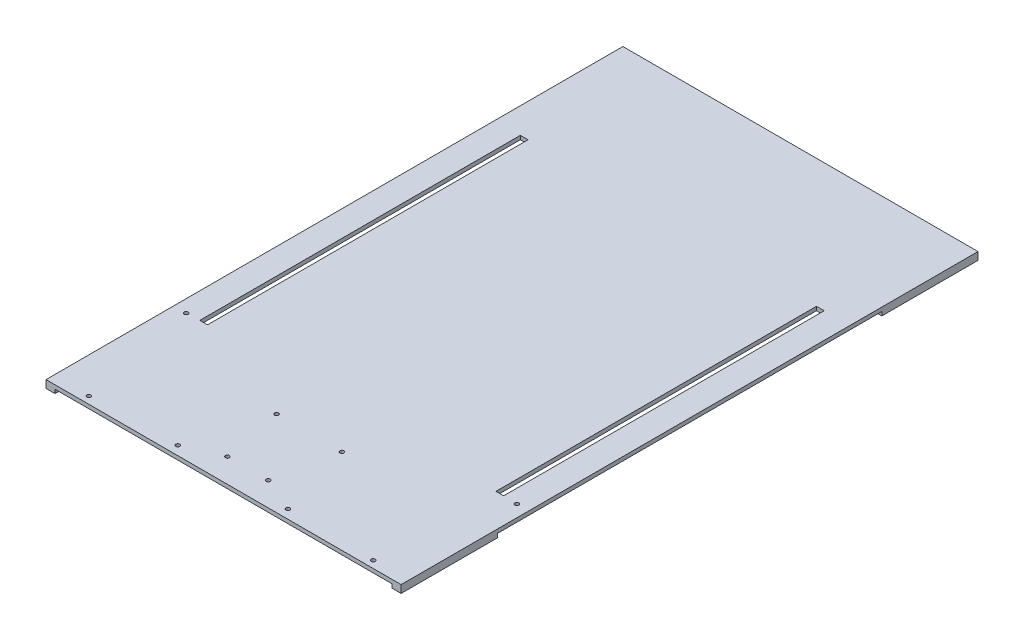
from build123d import *

# Parameters (mm, degrees)
SKETCH1_W           = 277
SKETCH1_H           = 3
BOSS_EXTRUDE1_DEPTH = 450
CUT_EXTRUDE1_REACH  = 520.295
SKETCH2_W           = 6
SKETCH2_H           = 250
CUT_EXTRUDE2_REACH  = 520.295
SKETCH3_R           = 1.55
SKETCH4_W           = 7
SKETCH4_H           = 75
SKETCH4_W_2         = 5
SKETCH4_H_2         = 35
BOSS_EXTRUDE2_DEPTH = 3


with BuildPart() as part:
    # Sketch1 → Boss-Extrude1 (new body)
    with BuildSketch(Plane.XY):
        with Locations((-118.640040599, -13.427850278)):
            Rectangle(SKETCH1_W, SKETCH1_H)
    extrude(amount=BOSS_EXTRUDE1_DEPTH)

    # Sketch2 → Cut-Extrude1 (cut, up to next)
    with BuildSketch(Plane(origin=(0, -11.927850278, 0), x_dir=(1, 0, 0), z_dir=(0, 1, 0)), mode=Mode.PRIVATE) as cut_extrude1_sk1:
        with Locations((-234.140040599, -225)):
            Rectangle(SKETCH2_W, SKETCH2_H)
    cut_extrude1_tool1 = extrude(cut_extrude1_sk1.sketch, amount=-CUT_EXTRUDE1_REACH, mode=Mode.PRIVATE) & part.part
    # Sketch2 → Cut-Extrude1 (cut, up to next)
    with BuildSketch(Plane(origin=(0, -11.927850278, 0), x_dir=(1, 0, 0), z_dir=(0, 1, 0)), mode=Mode.PRIVATE) as cut_extrude1_sk2:
        with Locations((-3.140040599, -225)):
            Rectangle(SKETCH2_W, SKETCH2_H)
    cut_extrude1_tool2 = extrude(cut_extrude1_sk2.sketch, amount=-CUT_EXTRUDE1_REACH, mode=Mode.PRIVATE) & part.part
    add(cut_extrude1_tool1.solids().sort_by_distance((-234.140041, -11.92785, 225))[0], mode=Mode.SUBTRACT)
    add(cut_extrude1_tool2.solids().sort_by_distance((-3.140041, -11.92785, 225))[0], mode=Mode.SUBTRACT)

    # Sketch3 → Cut-Extrude2 (cut, up to next)
    with BuildSketch(Plane(origin=(0, -11.927850278, 0), x_dir=(1, 0, 0), z_dir=(0, 1, 0)), mode=Mode.PRIVATE) as cut_extrude2_sk1:
        with Locations((-102.460040599, -431.322984009)):
            Circle(SKETCH3_R)
    cut_extrude2_tool1 = extrude(cut_extrude2_sk1.sketch, amount=-CUT_EXTRUDE2_REACH, mode=Mode.PRIVATE) & part.part
    # Sketch3 → Cut-Extrude2 (cut, up to next)
    with BuildSketch(Plane(origin=(0, -11.927850278, 0), x_dir=(1, 0, 0), z_dir=(0, 1, 0)), mode=Mode.PRIVATE) as cut_extrude2_sk2:
        with Locations((-75.460040599, -442.983238046)):
            Circle(SKETCH3_R)
    cut_extrude2_tool2 = extrude(cut_extrude2_sk2.sketch, amount=-CUT_EXTRUDE2_REACH, mode=Mode.PRIVATE) & part.part
    # Sketch3 → Cut-Extrude2 (cut, up to next)
    with BuildSketch(Plane(origin=(0, -11.927850278, 0), x_dir=(1, 0, 0), z_dir=(0, 1, 0)), mode=Mode.PRIVATE) as cut_extrude2_sk3:
        with Locations((-92.910040599, -383.404829271)):
            Circle(SKETCH3_R)
    cut_extrude2_tool3 = extrude(cut_extrude2_sk3.sketch, amount=-CUT_EXTRUDE2_REACH, mode=Mode.PRIVATE) & part.part
    # Sketch3 → Cut-Extrude2 (cut, up to next)
    with BuildSketch(Plane(origin=(0, -11.927850278, 0), x_dir=(1, 0, 0), z_dir=(0, 1, 0)), mode=Mode.PRIVATE) as cut_extrude2_sk4:
        with Locations((10.539959401, -350.404829271)):
            Circle(SKETCH3_R)
    cut_extrude2_tool4 = extrude(cut_extrude2_sk4.sketch, amount=-CUT_EXTRUDE2_REACH, mode=Mode.PRIVATE) & part.part
    # Sketch3 → Cut-Extrude2 (cut, up to next)
    with BuildSketch(Plane(origin=(0, -11.927850278, 0), x_dir=(1, 0, 0), z_dir=(0, 1, 0)), mode=Mode.PRIVATE) as cut_extrude2_sk5:
        with Locations((-7.460040599, -444.433238046)):
            Circle(SKETCH3_R)
    cut_extrude2_tool5 = extrude(cut_extrude2_sk5.sketch, amount=-CUT_EXTRUDE2_REACH, mode=Mode.PRIVATE) & part.part
    # Sketch3 → Cut-Extrude2 (cut, up to next)
    with BuildSketch(Plane(origin=(0, -11.927850278, 0), x_dir=(1, 0, 0), z_dir=(0, 1, 0)), mode=Mode.PRIVATE) as cut_extrude2_sk6:
        with Locations((-247.340040599, -350.40562763)):
            Circle(SKETCH3_R)
    cut_extrude2_tool6 = extrude(cut_extrude2_sk6.sketch, amount=-CUT_EXTRUDE2_REACH, mode=Mode.PRIVATE) & part.part
    # Sketch3 → Cut-Extrude2 (cut, up to next)
    with BuildSketch(Plane(origin=(0, -11.927850278, 0), x_dir=(1, 0, 0), z_dir=(0, 1, 0)), mode=Mode.PRIVATE) as cut_extrude2_sk7:
        with Locations((-229.340040599, -444.434036405)):
            Circle(SKETCH3_R)
    cut_extrude2_tool7 = extrude(cut_extrude2_sk7.sketch, amount=-CUT_EXTRUDE2_REACH, mode=Mode.PRIVATE) & part.part
    # Sketch3 → Cut-Extrude2 (cut, up to next)
    with BuildSketch(Plane(origin=(0, -11.927850278, 0), x_dir=(1, 0, 0), z_dir=(0, 1, 0)), mode=Mode.PRIVATE) as cut_extrude2_sk8:
        with Locations((-161.340040599, -442.984036405)):
            Circle(SKETCH3_R)
    cut_extrude2_tool8 = extrude(cut_extrude2_sk8.sketch, amount=-CUT_EXTRUDE2_REACH, mode=Mode.PRIVATE) & part.part
    # Sketch3 → Cut-Extrude2 (cut, up to next)
    with BuildSketch(Plane(origin=(0, -11.927850278, 0), x_dir=(1, 0, 0), z_dir=(0, 1, 0)), mode=Mode.PRIVATE) as cut_extrude2_sk9:
        with Locations((-134.340040599, -431.323782367)):
            Circle(SKETCH3_R)
    cut_extrude2_tool9 = extrude(cut_extrude2_sk9.sketch, amount=-CUT_EXTRUDE2_REACH, mode=Mode.PRIVATE) & part.part
    # Sketch3 → Cut-Extrude2 (cut, up to next)
    with BuildSketch(Plane(origin=(0, -11.927850278, 0), x_dir=(1, 0, 0), z_dir=(0, 1, 0)), mode=Mode.PRIVATE) as cut_extrude2_sk10:
        with Locations((-143.890040599, -383.40562763)):
            Circle(SKETCH3_R)
    cut_extrude2_tool10 = extrude(cut_extrude2_sk10.sketch, amount=-CUT_EXTRUDE2_REACH, mode=Mode.PRIVATE) & part.part
    add(cut_extrude2_tool1.solids().sort_by_distance((-102.460041, -11.92785, 431.322984))[0], mode=Mode.SUBTRACT)
    add(cut_extrude2_tool2.solids().sort_by_distance((-75.460041, -11.92785, 442.983238))[0], mode=Mode.SUBTRACT)
    add(cut_extrude2_tool3.solids().sort_by_distance((-92.910041, -11.92785, 383.404829))[0], mode=Mode.SUBTRACT)
    add(cut_extrude2_tool4.solids().sort_by_distance((10.539959, -11.92785, 350.404829))[0], mode=Mode.SUBTRACT)
    add(cut_extrude2_tool5.solids().sort_by_distance((-7.460041, -11.92785, 444.433238))[0], mode=Mode.SUBTRACT)
    add(cut_extrude2_tool6.solids().sort_by_distance((-247.340041, -11.92785, 350.405628))[0], mode=Mode.SUBTRACT)
    add(cut_extrude2_tool7.solids().sort_by_distance((-229.340041, -11.92785, 444.434036))[0], mode=Mode.SUBTRACT)
    add(cut_extrude2_tool8.solids().sort_by_distance((-161.340041, -11.92785, 442.984036))[0], mode=Mode.SUBTRACT)
    add(cut_extrude2_tool9.solids().sort_by_distance((-134.340041, -11.92785, 431.323782))[0], mode=Mode.SUBTRACT)
    add(cut_extrude2_tool10.solids().sort_by_distance((-143.890041, -11.92785, 383.405628))[0], mode=Mode.SUBTRACT)

    # Sketch4 → Boss-Extrude2 (add)
    with BuildSketch(Plane.XZ.offset(14.927850278)):
        with Locations((-253.640040599, 412.5)):
            Rectangle(SKETCH4_W, SKETCH4_H)
        with Locations((16.359959401, 412.5)):
            Rectangle(SKETCH4_W, SKETCH4_H)
        with Locations((-253.640040599, 37.5)):
            Rectangle(SKETCH4_W, SKETCH4_H)
        with Locations((16.359959401, 37.5)):
            Rectangle(SKETCH4_W, SKETCH4_H)
        with Locations((-118.640040599, 217.477852068)):
            Rectangle(SKETCH4_W_2, SKETCH4_H_2)
    extrude(amount=BOSS_EXTRUDE2_DEPTH)


solid = part.part
